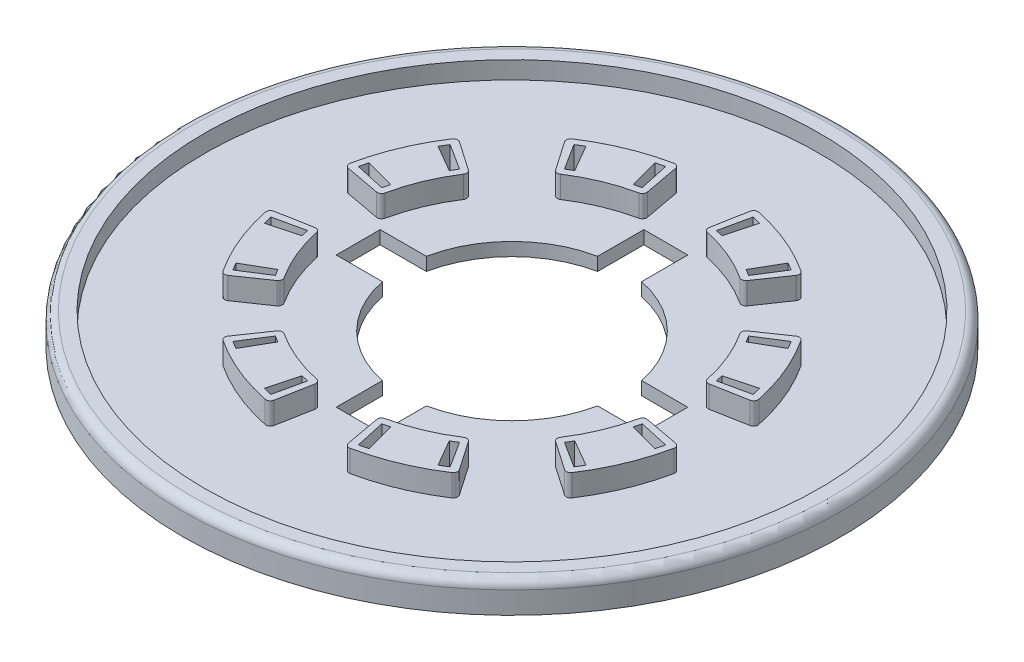
from build123d import *

# Parameters (mm, degrees)
CROQUIS1_R              = 75
SALIENTE_EXTRUIR1_DEPTH = 3
CROQUIS3_R              = 75
CROQUIS3_R_2            = 70
SALIENTE_EXTRUIR2_DEPTH = 4
CROQUIS4_R              = 25
CORTAR_EXTRUIR2_DEPTH   = 6
SALIENTE_EXTRUIR4_DEPTH = 5
CORTAR_EXTRUIR3_DEPTH   = 11
REDONDEO1_R             = 2
CROQUIS11_W             = 10
CROQUIS11_H             = 30
CROQUIS11_W_2           = 30
CROQUIS11_H_2           = 10
CORTAR_EXTRUIR4_DEPTH   = 10
CROQUIS2_R              = 3.75
CORTAR_EXTRUIR6_DEPTH   = 2.5


with BuildPart() as part:
    # Croquis1 → Saliente-Extruir1 (new body)
    with BuildSketch(Plane(origin=(0, 0, 0), x_dir=(1, 0, 0), z_dir=(0, 1, 0))):
        Circle(CROQUIS1_R)
    extrude(amount=SALIENTE_EXTRUIR1_DEPTH)

    # Croquis3 → Saliente-Extruir2 (add)
    with BuildSketch(Plane(origin=(0, 3, 0), x_dir=(1, 0, 0), z_dir=(0, 1, 0))):
        Circle(CROQUIS3_R)
        Circle(CROQUIS3_R_2, mode=Mode.SUBTRACT)
    extrude(amount=SALIENTE_EXTRUIR2_DEPTH)

    # Croquis4 → Cortar-Extruir2 (cut)
    with BuildSketch(Plane.XZ):
        Circle(CROQUIS4_R)
    extrude(amount=-CORTAR_EXTRUIR2_DEPTH, mode=Mode.SUBTRACT)

    # Croquis8 → Saliente-Extruir4 (add)
    with BuildSketch(Plane(origin=(0, 3, 0), x_dir=(1, 0, 0), z_dir=(0, 1, 0))):
        with BuildLine():
            Line((-45.710779346, -8.471992187), (-37.842542242, -7.013700637))
            ThreePointArc((-37.842542242, -7.013700637), (-37.104652096, -7.165542325), (-36.682116932, -7.789242414))
            ThreePointArc((-36.682116932, -7.789242414), (-34.645482469, -14.350628714), (-31.445999762, -20.4303475))
            ThreePointArc((-31.445999762, -20.4303475), (-31.303754679, -21.170147542), (-31.718153519, -21.799282955))
            Line((-31.718153519, -21.799282955), (-38.313005174, -26.331798923))
            ThreePointArc((-38.313005174, -26.331798923), (-39.072209645, -26.488911157), (-39.715527786, -26.056224836))
            ThreePointArc((-39.715527786, -26.056224836), (-43.884277794, -18.177463037), (-46.507652289, -9.658585742))
            ThreePointArc((-46.507652289, -9.658585742), (-46.358713101, -8.897735691), (-45.710779346, -8.471992187))
        make_face()
        with BuildLine():
            Line((-38.313005174, 26.331798923), (-31.718153519, 21.799282955))
            ThreePointArc((-31.718153519, 21.799282955), (-31.303754679, 21.170147542), (-31.445999762, 20.4303475))
            ThreePointArc((-31.445999762, 20.4303475), (-34.645482469, 14.350628714), (-36.682116932, 7.789242414))
            ThreePointArc((-36.682116932, 7.789242414), (-37.104652096, 7.165542325), (-37.842542242, 7.013700637))
            Line((-37.842542242, 7.013700637), (-45.710779346, 8.471992187))
            ThreePointArc((-45.710779346, 8.471992187), (-46.358713101, 8.897735691), (-46.507652289, 9.658585742))
            ThreePointArc((-46.507652289, 9.658585742), (-43.884277794, 18.177463037), (-39.715527786, 26.056224836))
            ThreePointArc((-39.715527786, 26.056224836), (-39.072209645, 26.488911157), (-38.313005174, 26.331798923))
        make_face()
        with BuildLine():
            Line((-8.471992187, 45.710779346), (-7.013700637, 37.842542242))
            ThreePointArc((-7.013700637, 37.842542242), (-7.165542325, 37.104652096), (-7.789242414, 36.682116932))
            ThreePointArc((-7.789242414, 36.682116932), (-14.350628714, 34.645482469), (-20.4303475, 31.445999762))
            ThreePointArc((-20.4303475, 31.445999762), (-21.170147542, 31.303754679), (-21.799282955, 31.718153519))
            Line((-21.799282955, 31.718153519), (-26.331798923, 38.313005174))
            ThreePointArc((-26.331798923, 38.313005174), (-26.488911157, 39.072209645), (-26.056224836, 39.715527786))
            ThreePointArc((-26.056224836, 39.715527786), (-18.177463037, 43.884277794), (-9.658585742, 46.507652289))
            ThreePointArc((-9.658585742, 46.507652289), (-8.897735691, 46.358713101), (-8.471992187, 45.710779346))
        make_face()
        with BuildLine():
            Line((26.331798923, 38.313005174), (21.799282955, 31.718153519))
            ThreePointArc((21.799282955, 31.718153519), (21.170147542, 31.303754679), (20.4303475, 31.445999762))
            ThreePointArc((20.4303475, 31.445999762), (14.350628714, 34.645482469), (7.789242414, 36.682116932))
            ThreePointArc((7.789242414, 36.682116932), (7.165542325, 37.104652096), (7.013700637, 37.842542242))
            Line((7.013700637, 37.842542242), (8.471992187, 45.710779346))
            ThreePointArc((8.471992187, 45.710779346), (8.897735691, 46.358713101), (9.658585742, 46.507652289))
            ThreePointArc((9.658585742, 46.507652289), (18.177463037, 43.884277794), (26.056224836, 39.715527786))
            ThreePointArc((26.056224836, 39.715527786), (26.488911157, 39.072209645), (26.331798923, 38.313005174))
        make_face()
        with BuildLine():
            Line((45.710779346, 8.471992187), (37.842542242, 7.013700637))
            ThreePointArc((37.842542242, 7.013700637), (37.104652096, 7.165542325), (36.682116932, 7.789242414))
            ThreePointArc((36.682116932, 7.789242414), (34.645482469, 14.350628714), (31.445999762, 20.4303475))
            ThreePointArc((31.445999762, 20.4303475), (31.303754679, 21.170147542), (31.718153519, 21.799282955))
            Line((31.718153519, 21.799282955), (38.313005174, 26.331798923))
            ThreePointArc((38.313005174, 26.331798923), (39.072209645, 26.488911157), (39.715527786, 26.056224836))
            ThreePointArc((39.715527786, 26.056224836), (43.884277794, 18.177463037), (46.507652289, 9.658585742))
            ThreePointArc((46.507652289, 9.658585742), (46.358713101, 8.897735691), (45.710779346, 8.471992187))
        make_face()
        with BuildLine():
            Line((38.313005174, -26.331798923), (31.718153519, -21.799282955))
            ThreePointArc((31.718153519, -21.799282955), (31.303754679, -21.170147542), (31.445999762, -20.4303475))
            ThreePointArc((31.445999762, -20.4303475), (34.645482469, -14.350628714), (36.682116932, -7.789242414))
            ThreePointArc((36.682116932, -7.789242414), (37.104652096, -7.165542325), (37.842542242, -7.013700637))
            Line((37.842542242, -7.013700637), (45.710779346, -8.471992187))
            ThreePointArc((45.710779346, -8.471992187), (46.358713101, -8.897735691), (46.507652289, -9.658585742))
            ThreePointArc((46.507652289, -9.658585742), (43.884277794, -18.177463037), (39.715527786, -26.056224836))
            ThreePointArc((39.715527786, -26.056224836), (39.072209645, -26.488911157), (38.313005174, -26.331798923))
        make_face()
        with BuildLine():
            Line((8.471992187, -45.710779346), (7.013700637, -37.842542242))
            ThreePointArc((7.013700637, -37.842542242), (7.165542325, -37.104652096), (7.789242414, -36.682116932))
            ThreePointArc((7.789242414, -36.682116932), (14.350628714, -34.645482469), (20.4303475, -31.445999762))
            ThreePointArc((20.4303475, -31.445999762), (21.170147542, -31.303754679), (21.799282955, -31.718153519))
            Line((21.799282955, -31.718153519), (26.331798923, -38.313005174))
            ThreePointArc((26.331798923, -38.313005174), (26.488911157, -39.072209645), (26.056224836, -39.715527786))
            ThreePointArc((26.056224836, -39.715527786), (18.177463037, -43.884277794), (9.658585742, -46.507652289))
            ThreePointArc((9.658585742, -46.507652289), (8.897735691, -46.358713101), (8.471992187, -45.710779346))
        make_face()
        with BuildLine():
            Line((-26.331798923, -38.313005174), (-21.799282955, -31.718153519))
            ThreePointArc((-21.799282955, -31.718153519), (-21.170147542, -31.303754679), (-20.4303475, -31.445999762))
            ThreePointArc((-20.4303475, -31.445999762), (-14.350628714, -34.645482469), (-7.789242414, -36.682116932))
            ThreePointArc((-7.789242414, -36.682116932), (-7.165542325, -37.104652096), (-7.013700637, -37.842542242))
            Line((-7.013700637, -37.842542242), (-8.471992187, -45.710779346))
            ThreePointArc((-8.471992187, -45.710779346), (-8.897735691, -46.358713101), (-9.658585742, -46.507652289))
            ThreePointArc((-9.658585742, -46.507652289), (-18.177463037, -43.884277794), (-26.056224836, -39.715527786))
            ThreePointArc((-26.056224836, -39.715527786), (-26.488911157, -39.072209645), (-26.331798923, -38.313005174))
        make_face()
    extrude(amount=SALIENTE_EXTRUIR4_DEPTH)

    # Croquis10 → Cortar-Extruir3 (cut)
    with BuildSketch(Plane(origin=(0, 8, 0), x_dir=(1, 0, 0), z_dir=(0, 1, 0))):
        with BuildLine():
            Line((-44.909616328, -9.956222241), (-38.075544278, -8.441144944))
            ThreePointArc((-38.075544278, -8.441144944), (-37.882340723, -9.269749801), (-37.671107225, -10.093942759))
            Line((-37.671107225, -10.093942759), (-44.432588009, -11.905676075))
            ThreePointArc((-44.432588009, -11.905676075), (-44.681735211, -10.933551047), (-44.909616328, -9.956222241))
        make_face()
        with BuildLine():
            Line((-39.837168574, 23), (-33.774990748, 19.5))
            ThreePointArc((-33.774990748, 19.5), (-33.341562956, 20.232157068), (-32.892266387, 20.954684726))
            Line((-32.892266387, 20.954684726), (-38.796006507, 24.715781984))
            ThreePointArc((-38.796006507, 24.715781984), (-39.325946051, 23.863569875), (-39.837168574, 23))
        make_face()
        with BuildLine():
            Line((-38.796006507, -24.715781984), (-32.892266387, -20.954684726))
            ThreePointArc((-32.892266387, -20.954684726), (-33.341562956, -20.232157068), (-33.774990748, -19.5))
            Line((-33.774990748, -19.5), (-39.837168574, -23))
            ThreePointArc((-39.837168574, -23), (-39.325946051, -23.863569875), (-38.796006507, -24.715781984))
        make_face()
        with BuildLine():
            Line((-44.909616328, 9.956222241), (-38.075544278, 8.441144944))
            ThreePointArc((-38.075544278, 8.441144944), (-37.882340723, 9.269749801), (-37.671107225, 10.093942759))
            Line((-37.671107225, 10.093942759), (-44.432588009, 11.905676075))
            ThreePointArc((-44.432588009, 11.905676075), (-44.681735211, 10.933551047), (-44.909616328, 9.956222241))
        make_face()
        with BuildLine():
            Line((-11.905676075, 44.432588009), (-10.093942759, 37.671107225))
            ThreePointArc((-10.093942759, 37.671107225), (-9.269749801, 37.882340723), (-8.441144944, 38.075544278))
            Line((-8.441144944, 38.075544278), (-9.956222241, 44.909616328))
            ThreePointArc((-9.956222241, 44.909616328), (-10.933551047, 44.681735211), (-11.905676075, 44.432588009))
        make_face()
        with BuildLine():
            Line((-24.715781984, 38.796006507), (-20.954684726, 32.892266387))
            ThreePointArc((-20.954684726, 32.892266387), (-20.232157068, 33.341562956), (-19.5, 33.774990748))
            Line((-19.5, 33.774990748), (-23, 39.837168574))
            ThreePointArc((-23, 39.837168574), (-23.863569875, 39.325946051), (-24.715781984, 38.796006507))
        make_face()
        with BuildLine():
            Line((23, 39.837168574), (19.5, 33.774990748))
            ThreePointArc((19.5, 33.774990748), (20.232157068, 33.341562956), (20.954684726, 32.892266387))
            Line((20.954684726, 32.892266387), (24.715781984, 38.796006507))
            ThreePointArc((24.715781984, 38.796006507), (23.863569875, 39.325946051), (23, 39.837168574))
        make_face()
        with BuildLine():
            Line((9.956222241, 44.909616328), (8.441144944, 38.075544278))
            ThreePointArc((8.441144944, 38.075544278), (9.269749801, 37.882340723), (10.093942759, 37.671107225))
            Line((10.093942759, 37.671107225), (11.905676075, 44.432588009))
            ThreePointArc((11.905676075, 44.432588009), (10.933551047, 44.681735211), (9.956222241, 44.909616328))
        make_face()
        with BuildLine():
            Line((44.432588009, 11.905676075), (37.671107225, 10.093942759))
            ThreePointArc((37.671107225, 10.093942759), (37.882340723, 9.269749801), (38.075544278, 8.441144944))
            Line((38.075544278, 8.441144944), (44.909616328, 9.956222241))
            ThreePointArc((44.909616328, 9.956222241), (44.681735211, 10.933551047), (44.432588009, 11.905676075))
        make_face()
        with BuildLine():
            Line((38.796006507, 24.715781984), (32.892266387, 20.954684726))
            ThreePointArc((32.892266387, 20.954684726), (33.341562956, 20.232157068), (33.774990748, 19.5))
            Line((33.774990748, 19.5), (39.837168574, 23))
            ThreePointArc((39.837168574, 23), (39.325946051, 23.863569875), (38.796006507, 24.715781984))
        make_face()
        with BuildLine():
            Line((39.837168574, -23), (33.774990748, -19.5))
            ThreePointArc((33.774990748, -19.5), (33.341562956, -20.232157068), (32.892266387, -20.954684726))
            Line((32.892266387, -20.954684726), (38.796006507, -24.715781984))
            ThreePointArc((38.796006507, -24.715781984), (39.325946051, -23.863569875), (39.837168574, -23))
        make_face()
        with BuildLine():
            Line((44.909616328, -9.956222241), (38.075544278, -8.441144944))
            ThreePointArc((38.075544278, -8.441144944), (37.882340723, -9.269749801), (37.671107225, -10.093942759))
            Line((37.671107225, -10.093942759), (44.432588009, -11.905676075))
            ThreePointArc((44.432588009, -11.905676075), (44.681735211, -10.933551047), (44.909616328, -9.956222241))
        make_face()
        with BuildLine():
            Line((11.905676075, -44.432588009), (10.093942759, -37.671107225))
            ThreePointArc((10.093942759, -37.671107225), (9.269749801, -37.882340723), (8.441144944, -38.075544278))
            Line((8.441144944, -38.075544278), (9.956222241, -44.909616328))
            ThreePointArc((9.956222241, -44.909616328), (10.933551047, -44.681735211), (11.905676075, -44.432588009))
        make_face()
        with BuildLine():
            Line((24.715781984, -38.796006507), (20.954684726, -32.892266387))
            ThreePointArc((20.954684726, -32.892266387), (20.232157068, -33.341562956), (19.5, -33.774990748))
            Line((19.5, -33.774990748), (23, -39.837168574))
            ThreePointArc((23, -39.837168574), (23.863569875, -39.325946051), (24.715781984, -38.796006507))
        make_face()
        with BuildLine():
            Line((-23, -39.837168574), (-19.5, -33.774990748))
            ThreePointArc((-19.5, -33.774990748), (-20.232157068, -33.341562956), (-20.954684726, -32.892266387))
            Line((-20.954684726, -32.892266387), (-24.715781984, -38.796006507))
            ThreePointArc((-24.715781984, -38.796006507), (-23.863569875, -39.325946051), (-23, -39.837168574))
        make_face()
        with BuildLine():
            Line((-9.956222241, -44.909616328), (-8.441144944, -38.075544278))
            ThreePointArc((-8.441144944, -38.075544278), (-9.269749801, -37.882340723), (-10.093942759, -37.671107225))
            Line((-10.093942759, -37.671107225), (-11.905676075, -44.432588009))
            ThreePointArc((-11.905676075, -44.432588009), (-10.933551047, -44.681735211), (-9.956222241, -44.909616328))
        make_face()
    extrude(amount=-CORTAR_EXTRUIR3_DEPTH, mode=Mode.SUBTRACT)

    # Redondeo1
    redondeo1_edges = [part.edges().sort_by_distance(p)[0] for p in [
        (-75, 7, 0),
    ]]
    fillet(redondeo1_edges, radius=REDONDEO1_R)

    # Croquis11 → Cortar-Extruir4 (cut)
    with BuildSketch(Plane(origin=(0, 3, 0), x_dir=(1, 0, 0), z_dir=(0, 1, 0))):
        with Locations((0, -20)):
            Rectangle(CROQUIS11_W, CROQUIS11_H)
        with Locations((-20, 0)):
            Rectangle(CROQUIS11_W_2, CROQUIS11_H_2)
        with Locations((20, 0)):
            Rectangle(CROQUIS11_W_2, CROQUIS11_H_2)
        with Locations((0, 20)):
            Rectangle(CROQUIS11_W, CROQUIS11_H)
    extrude(amount=-CORTAR_EXTRUIR4_DEPTH, mode=Mode.SUBTRACT)

    # Croquis2 → Cortar-Extruir6 (cut)
    with BuildSketch(Plane.XZ):
        with Locations((-55.432771951, 22.961005942)):
            Circle(CROQUIS2_R)
        with Locations((-22.961005942, 55.432771951)):
            Circle(CROQUIS2_R)
        with Locations((22.961005942, 55.432771951)):
            Circle(CROQUIS2_R)
        with Locations((55.432771951, 22.961005942)):
            Circle(CROQUIS2_R)
        with Locations((55.432771951, -22.961005942)):
            Circle(CROQUIS2_R)
        with Locations((22.961005942, -55.432771951)):
            Circle(CROQUIS2_R)
        with Locations((-22.961005942, -55.432771951)):
            Circle(CROQUIS2_R)
        with Locations((-55.432771951, -22.961005942)):
            Circle(CROQUIS2_R)
    extrude(amount=-CORTAR_EXTRUIR6_DEPTH, mode=Mode.SUBTRACT)


solid = part.part
